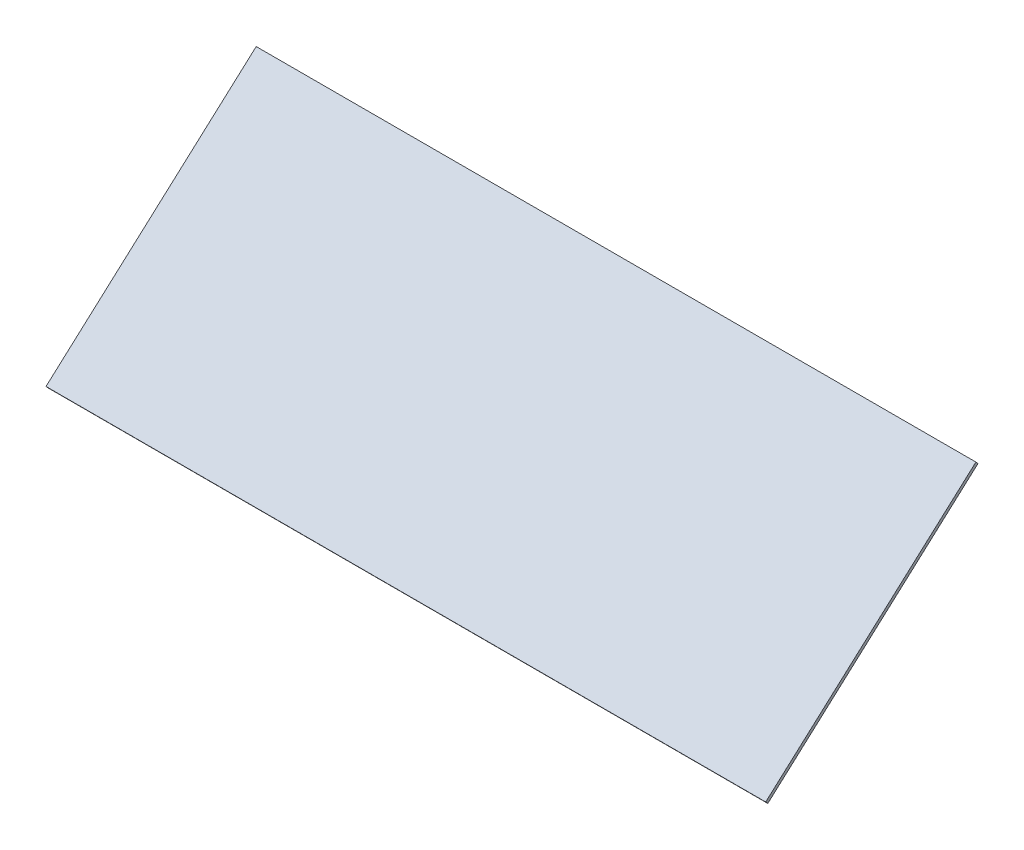
from build123d import *

# Parameters (mm, degrees)
SM_BASE_FLANGE_1_DEPTH = 114.5


# Sheet-metal steps are written as plain solids
with BuildPart() as part:
    # Sketch 1 → 基体-法兰1 (new, symmetric)
    with BuildSketch(Plane(origin=(0, 0, 0), x_dir=(0, 0, -1), z_dir=(1, 0, 0))):
        Polygon((0, 0), (66.883034293, 60.221754572), (67.552164899, 59.478609747), (0.669130606, -0.743144825), align=None)
    extrude(amount=SM_BASE_FLANGE_1_DEPTH, both=True)


solid = part.part
